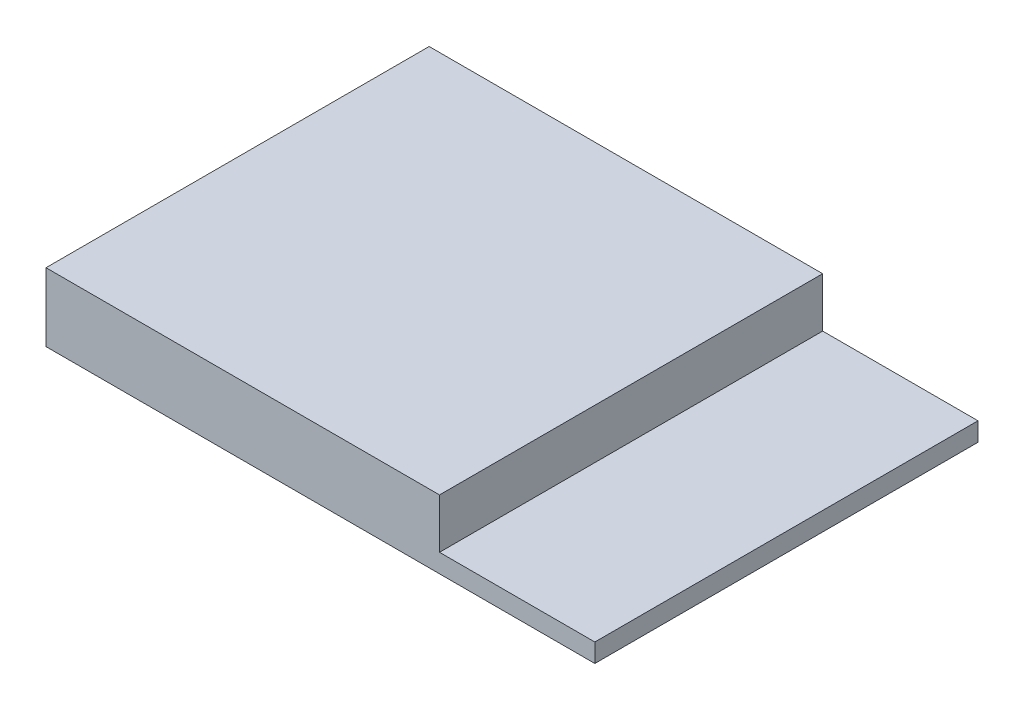
from build123d import *

# Parameters (mm, degrees)
SKETCH1_W                  = 52
SKETCH1_H                  = 28.5
SKETCH1_R                  = 1.6
BOSS_EXTRUDE1_DEPTH        = 1.6
FILLET1_R                  = 2
SKETCH2_W                  = 6
SKETCH2_H                  = 8
BOSS_EXTRUDE2_DEPTH        = 2.6
SKETCH3_W                  = 26.5
SKETCH3_H                  = 18.5
BOSS_EXTRUDE3_DEPTH        = 0.9
SKETCH4_W                  = 19
SKETCH4_H                  = 18.5
BOSS_EXTRUDE4_DEPTH        = 2.4
SKETCH5_W                  = 4.480247742
SKETCH5_H                  = 2.767211841
SKETCH5_H_2                = 2.398250262
BOSS_EXTRUDE5_DEPTH        = 2
CUT_EXTRUDE1_START         = -1.6
CUT_EXTRUDE1_OUTLINE_R     = 1.6
CUT_EXTRUDE1_DEPTH         = 1.6
CUT_EXTRUDE1_2_OUTLINE_W   = 6
CUT_EXTRUDE1_2_OUTLINE_H   = 8
CUT_EXTRUDE1_2_OUTLINE_W_2 = 4.480247742
CUT_EXTRUDE1_2_OUTLINE_H_2 = 2.767211841
CUT_EXTRUDE1_2_OUTLINE_H_3 = 2.398250262
CUT_EXTRUDE1_2_DEPTH       = 2.6


# Read off the part's stored shape, not the designer's step: Cut-Extrude1
with BuildPart() as part:
    # Sketch1 → Boss-Extrude1 (new body)
    with BuildSketch(Plane(origin=(0, 0, 0), x_dir=(1, 0, 0), z_dir=(0, 1, 0))):
        Rectangle(SKETCH1_W, SKETCH1_H)
        with Locations(Location((-23.7, 11.55, 0), (0, 0, 270))):
            Circle(SKETCH1_R, mode=Mode.SUBTRACT)
        with Locations(Location((-23.7, -11.55, 0), (0, 0, 270))):
            Circle(SKETCH1_R, mode=Mode.SUBTRACT)
        with Locations(Location((23.4, 11.55, 0), (0, 0, 270))):
            Circle(SKETCH1_R, mode=Mode.SUBTRACT)
        with Locations(Location((23.4, -11.55, 0), (0, 0, 270))):
            Circle(SKETCH1_R, mode=Mode.SUBTRACT)
    extrude(amount=BOSS_EXTRUDE1_DEPTH)

    # Fillet1
    fillet1_edges = [part.edges().sort_by_distance(p)[0] for p in [
        (-26, 0.8, -14.25),
        (26, 0.8, -14.25),
        (26, 0.8, 14.25),
        (-26, 0.8, 14.25),
    ]]
    fillet(fillet1_edges, radius=FILLET1_R)

    # Sketch2 → Boss-Extrude2 (add)
    with BuildSketch(Plane(origin=(0, 1.6, 0), x_dir=(1, 0, 0), z_dir=(0, 1, 0))):
        with Locations((-23, 0)):
            Rectangle(SKETCH2_W, SKETCH2_H)
    extrude(amount=BOSS_EXTRUDE2_DEPTH)

    # Sketch3 → Boss-Extrude3 (add)
    with BuildSketch(Plane(origin=(0, 1.6, 0), x_dir=(1, 0, 0), z_dir=(0, 1, 0))):
        with Locations((12.75, 0)):
            Rectangle(SKETCH3_W, SKETCH3_H)
    extrude(amount=BOSS_EXTRUDE3_DEPTH)

    # Sketch4 → Boss-Extrude4 (add)
    with BuildSketch(Plane(origin=(0, 2.5, 0), x_dir=(1, 0, 0), z_dir=(0, 1, 0))):
        with Locations((9, 0)):
            Rectangle(SKETCH4_W, SKETCH4_H)
    extrude(amount=BOSS_EXTRUDE4_DEPTH)

    # Sketch5 → Boss-Extrude5 (add)
    with BuildSketch(Plane(origin=(0, 1.6, 0), x_dir=(1, 0, 0), z_dir=(0, 1, 0))):
        with Locations((-23.323642657, 8.222572326)):
            Rectangle(SKETCH5_W, SKETCH5_H)
        with Locations((-23.323642657, -8.459761913)):
            Rectangle(SKETCH5_W, SKETCH5_H_2)
    extrude(amount=BOSS_EXTRUDE5_DEPTH)

    # Cut-Extrude1 outline → Cut-Extrude1 (cut)
    with BuildSketch(Plane(origin=(0, 1.6, 0), x_dir=(1, 0, 0), z_dir=(0, 1, 0)).offset(CUT_EXTRUDE1_START)):
        with BuildLine():
            ThreePointArc((-26, -12.25), (-25.414213562, -13.664213562), (-24, -14.25))
            Line((-24, -14.25), (24, -14.25))
            ThreePointArc((24, -14.25), (25.414213562, -13.664213562), (26, -12.25))
            Line((26, -12.25), (26, 12.25))
            ThreePointArc((26, 12.25), (25.414213562, 13.664213562), (24, 14.25))
            Line((24, 14.25), (-24, 14.25))
            ThreePointArc((-24, 14.25), (-25.414213562, 13.664213562), (-26, 12.25))
            Line((-26, 12.25), (-26, -12.25))
        make_face()
        with Locations((-23.7, -11.55)):
            Circle(CUT_EXTRUDE1_OUTLINE_R, mode=Mode.SUBTRACT)
        with Locations((23.4, -11.55)):
            Circle(CUT_EXTRUDE1_OUTLINE_R, mode=Mode.SUBTRACT)
        with Locations((-23.7, 11.55)):
            Circle(CUT_EXTRUDE1_OUTLINE_R, mode=Mode.SUBTRACT)
        with Locations((23.4, 11.55)):
            Circle(CUT_EXTRUDE1_OUTLINE_R, mode=Mode.SUBTRACT)
    extrude(amount=CUT_EXTRUDE1_DEPTH, mode=Mode.SUBTRACT)

    # Cut-Extrude1 2 outline → Cut-Extrude1 2 (cut)
    with BuildSketch(Plane(origin=(0, 1.6, 0), x_dir=(1, 0, 0), z_dir=(0, 1, 0))):
        with Locations((-23, 0)):
            Rectangle(CUT_EXTRUDE1_2_OUTLINE_W, CUT_EXTRUDE1_2_OUTLINE_H)
        with Locations((-23.323642657, 8.222572326)):
            Rectangle(CUT_EXTRUDE1_2_OUTLINE_W_2, CUT_EXTRUDE1_2_OUTLINE_H_2)
        with Locations((-23.323642657, -8.459761913)):
            Rectangle(CUT_EXTRUDE1_2_OUTLINE_W_2, CUT_EXTRUDE1_2_OUTLINE_H_3)
    extrude(amount=CUT_EXTRUDE1_2_DEPTH, mode=Mode.SUBTRACT)


solid = part.part
